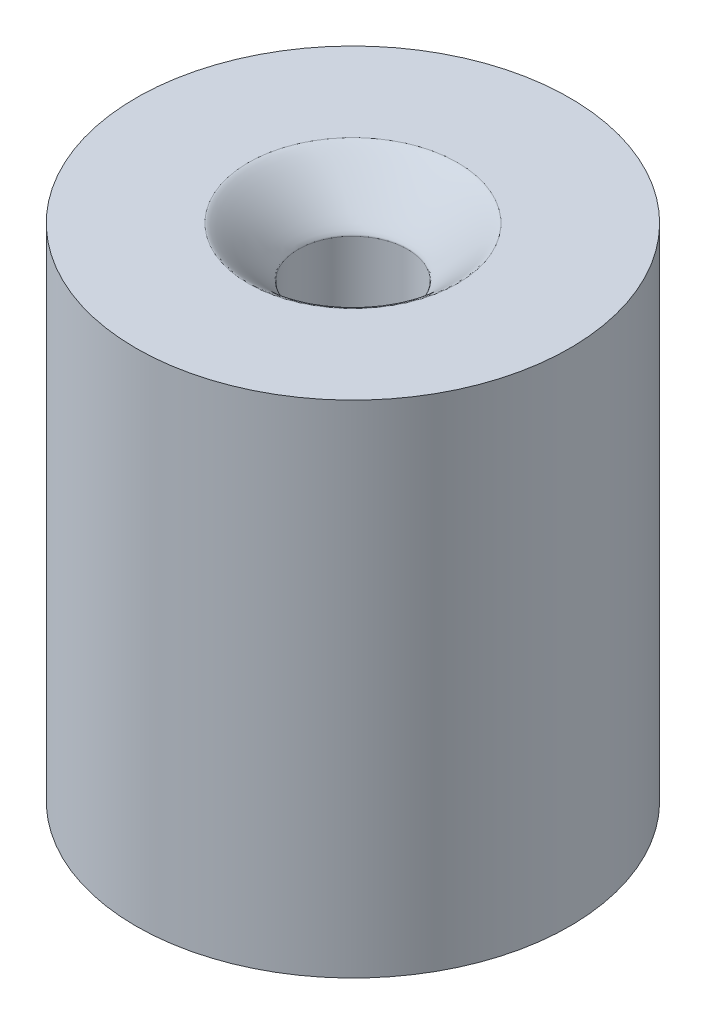
from build123d import *

# Parameters (mm, degrees)
SKETCH1_R               = 6.5
BOSS_EXTRUDE1_DEPTH     = 15
CUT_EXTRUDE1_DEPTH      = 18.592612086
CUT_EXTRUDE1_DEPTH_BACK = 18.592612086
SKETCH2_R               = 1.6383
FILLET1_SIZE            = 1.5


with BuildPart() as part:
    # Sketch1 → Boss-Extrude1 (new body)
    with BuildSketch(Plane(origin=(0, 0, 0), x_dir=(1, 0, 0), z_dir=(0, 1, 0))):
        with Locations(Location((0, 0, 0), (0, 0, 270))):
            Circle(SKETCH1_R)
    extrude(amount=BOSS_EXTRUDE1_DEPTH)

    # Sketch2 → Cut-Extrude1 (cut, two sides: drawn at the far end of the back side and taken through both)
    with BuildSketch(Plane(origin=(0, 15, 0), x_dir=(1, 0, 0), z_dir=(0, 1, 0)).offset(-CUT_EXTRUDE1_DEPTH_BACK)):
        with Locations(Location((0, 0, 0), (0, 0, 270))):
            Circle(SKETCH2_R)
    extrude(amount=CUT_EXTRUDE1_DEPTH + CUT_EXTRUDE1_DEPTH_BACK, mode=Mode.SUBTRACT)

    # Fillet1
    # a fillet whose section is not a circle: 1.5 mm, written as the material it takes off along each edge
    with BuildSketch(Plane(origin=(0, 15, 0), x_dir=(0, 0, 1), z_dir=(-1, 0, 0))) as fillet1_piece_1:
        with BuildLine():
            Bezier((1.6383 + FILLET1_SIZE, 0), (1.6383, 0), (1.6383, -FILLET1_SIZE), weights=[1, 0.106066017, 1])
            Line((1.6383, -FILLET1_SIZE), (1.6383, 0))
            Line((1.6383, 0), (1.6383 + FILLET1_SIZE, 0))
        make_face()
    revolve(axis=Axis((0, 15, 0), (0, 1, 0)), mode=Mode.SUBTRACT)


solid = part.part
